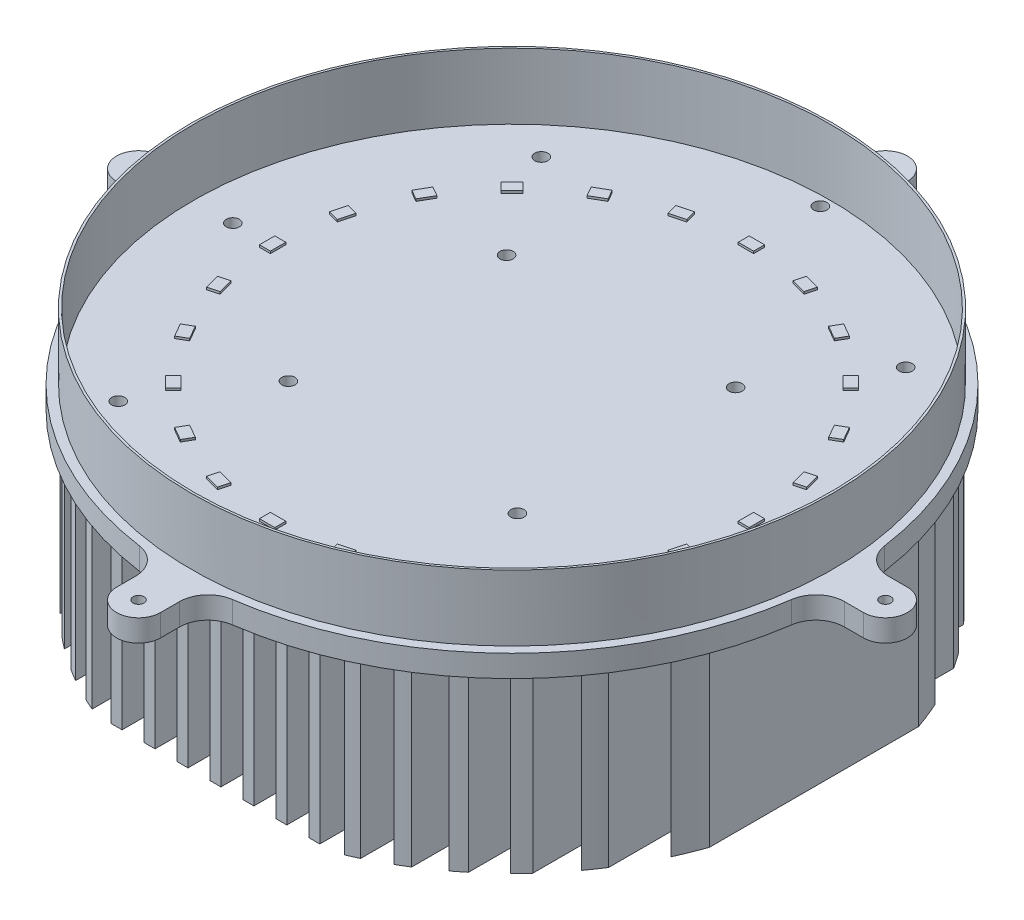
from build123d import *

# Parameters (mm, degrees)
SKETCH2_R           = 146
SKETCH2_R_2         = 145
BOSS_EXTRUDE2_DEPTH = 30
SKETCH3_R           = 2.5
BOSS_EXTRUDE4_DEPTH = 10
SKETCH4_W           = 5
SKETCH4_H           = 270
BOSS_EXTRUDE5_DEPTH = 80
BOSS_EXTRUDE6_DEPTH = 1
SKETCH7_R           = 3
CUT_EXTRUDE1_DEPTH  = 10


with BuildPart() as part:
    # Sketch2 → Boss-Extrude2 (new body)
    with BuildSketch(Plane(origin=(0, 0, 0), x_dir=(1, 0, 0), z_dir=(0, 1, 0))):
        Circle(SKETCH2_R)
        Circle(SKETCH2_R_2, mode=Mode.SUBTRACT)
    extrude(amount=BOSS_EXTRUDE2_DEPTH)

    # Sketch3 → Boss-Extrude4 (add)
    with BuildSketch(Plane(origin=(0, 0, 0), x_dir=(1, 0, 0), z_dir=(0, 1, 0))):
        with BuildLine():
            Line((161.369142032, 10), (170, 10))
            ThreePointArc((170, 10), (180, 0), (170, -10))
            Line((170, -10), (161.369142032, -10))
            ThreePointArc((161.369142032, -10), (152.849946816, -13.180462695), (148.499210458, -21.165644172))
            ThreePointArc((148.499210458, -21.165644172), (106.066017178, -106.066017178), (21.165644172, -148.499210458))
            ThreePointArc((21.165644172, -148.499210458), (13.180462695, -152.849946816), (10, -161.369142032))
            Line((10, -161.369142032), (10, -170))
            ThreePointArc((10, -170), (0, -180), (-10, -170))
            Line((-10, -170), (-10, -161.369142032))
            ThreePointArc((-10, -161.369142032), (-13.180462695, -152.849946816), (-21.165644172, -148.499210458))
            ThreePointArc((-21.165644172, -148.499210458), (-106.066017178, -106.066017178), (-148.499210458, -21.165644172))
            ThreePointArc((-148.499210458, -21.165644172), (-152.849946816, -13.180462695), (-161.369142032, -10))
            Line((-161.369142032, -10), (-170, -10))
            ThreePointArc((-170, -10), (-180, 0), (-170, 10))
            Line((-170, 10), (-161.369142032, 10))
            ThreePointArc((-161.369142032, 10), (-152.849946816, 13.180462695), (-148.499210458, 21.165644172))
            ThreePointArc((-148.499210458, 21.165644172), (-106.066017178, 106.066017178), (-21.165644172, 148.499210458))
            ThreePointArc((-21.165644172, 148.499210458), (-13.180462695, 152.849946816), (-10, 161.369142032))
            Line((-10, 161.369142032), (-10, 170))
            ThreePointArc((-10, 170), (0, 180), (10, 170))
            Line((10, 170), (10, 161.369142032))
            ThreePointArc((10, 161.369142032), (13.180462695, 152.849946816), (21.165644172, 148.499210458))
            ThreePointArc((21.165644172, 148.499210458), (106.066017178, 106.066017178), (148.499210458, 21.165644172))
            ThreePointArc((148.499210458, 21.165644172), (152.849946816, 13.180462695), (161.369142032, 10))
        make_face()
        with Locations((0, 170)):
            Circle(SKETCH3_R, mode=Mode.SUBTRACT)
        with Locations((170, 0)):
            Circle(SKETCH3_R, mode=Mode.SUBTRACT)
        with Locations((0, -170)):
            Circle(SKETCH3_R, mode=Mode.SUBTRACT)
        with Locations((-170, 0)):
            Circle(SKETCH3_R, mode=Mode.SUBTRACT)
    extrude(amount=-BOSS_EXTRUDE4_DEPTH)

    # Sketch4 → Boss-Extrude5 (add)
    with BuildSketch(Plane.XZ.offset(10)):
        Rectangle(SKETCH4_W, SKETCH4_H)
        with Locations((15, 0)):
            Rectangle(SKETCH4_W, SKETCH4_H)
        with Locations((30, 0)):
            Rectangle(SKETCH4_W, SKETCH4_H)
        with Locations((45, 0)):
            Rectangle(SKETCH4_W, SKETCH4_H)
        with BuildLine():
            Line((57.5, -133.656275573), (57.5, 133.656275573))
            ThreePointArc((57.5, 133.656275573), (60.010675074, 132.547987073), (62.5, 131.392541645))
            Line((62.5, 131.392541645), (62.5, -131.392541645))
            ThreePointArc((62.5, -131.392541645), (60.010675074, -132.547987073), (57.5, -133.656275573))
        make_face()
        with BuildLine():
            Line((72.5, -126.150703526), (72.5, 126.150703526))
            ThreePointArc((72.5, 126.150703526), (75.015083697, 124.671517268), (77.5, 123.142194231))
            Line((77.5, 123.142194231), (77.5, -123.142194231))
            ThreePointArc((77.5, -123.142194231), (75.015083697, -124.671517268), (72.5, -126.150703526))
        make_face()
        with BuildLine():
            Line((87.5, -116.249731182), (87.5, 116.249731182))
            ThreePointArc((87.5, 116.249731182), (90.021532442, 114.308239846), (92.5, 112.312065247))
            Line((92.5, 112.312065247), (92.5, -112.312065247))
            ThreePointArc((92.5, -112.312065247), (90.021532442, -114.308239846), (87.5, -116.249731182))
        make_face()
        with BuildLine():
            Line((102.5, -103.266645147), (102.5, 103.266645147))
            ThreePointArc((102.5, 103.266645147), (105.032379388, 100.689866819), (107.5, 98.051007134))
            Line((107.5, 98.051007134), (107.5, -98.051007134))
            ThreePointArc((107.5, -98.051007134), (105.032379388, -100.689866819), (102.5, -103.266645147))
        make_face()
        with BuildLine():
            Line((117.5, -85.813751812), (117.5, 85.813751812))
            ThreePointArc((117.5, 85.813751812), (120.055537207, 82.200474366), (122.5, 78.511145706))
            Line((122.5, 78.511145706), (122.5, -78.511145706))
            ThreePointArc((122.5, -78.511145706), (120.055537207, -82.200474366), (117.5, -85.813751812))
        make_face()
        with BuildLine():
            Line((132.5, -60.116553461), (132.5, 60.116553461))
            ThreePointArc((132.5, 60.116553461), (135.145409966, 53.907032613), (137.5, 47.581509013))
            Line((137.5, 47.581509013), (137.5, -47.581509013))
            ThreePointArc((137.5, -47.581509013), (135.145409966, -53.907032613), (132.5, -60.116553461))
        make_face()
        with Locations((-15, 0)):
            Rectangle(SKETCH4_W, SKETCH4_H)
        with Locations((-30, 0)):
            Rectangle(SKETCH4_W, SKETCH4_H)
        with Locations((-45, 0)):
            Rectangle(SKETCH4_W, SKETCH4_H)
        with BuildLine():
            Line((-57.5, -133.656275573), (-57.5, 133.656275573))
            ThreePointArc((-57.5, 133.656275573), (-60.010675074, 132.547987073), (-62.5, 131.392541645))
            Line((-62.5, 131.392541645), (-62.5, -131.392541645))
            ThreePointArc((-62.5, -131.392541645), (-60.010675074, -132.547987073), (-57.5, -133.656275573))
        make_face()
        with BuildLine():
            Line((-72.5, -126.150703526), (-72.5, 126.150703526))
            ThreePointArc((-72.5, 126.150703526), (-75.015083697, 124.671517268), (-77.5, 123.142194231))
            Line((-77.5, 123.142194231), (-77.5, -123.142194231))
            ThreePointArc((-77.5, -123.142194231), (-75.015083697, -124.671517268), (-72.5, -126.150703526))
        make_face()
        with BuildLine():
            Line((-87.5, -116.249731182), (-87.5, 116.249731182))
            ThreePointArc((-87.5, 116.249731182), (-90.021532442, 114.308239846), (-92.5, 112.312065247))
            Line((-92.5, 112.312065247), (-92.5, -112.312065247))
            ThreePointArc((-92.5, -112.312065247), (-90.021532442, -114.308239846), (-87.5, -116.249731182))
        make_face()
        with BuildLine():
            Line((-102.5, -103.266645147), (-102.5, 103.266645147))
            ThreePointArc((-102.5, 103.266645147), (-105.032379388, 100.689866819), (-107.5, 98.051007134))
            Line((-107.5, 98.051007134), (-107.5, -98.051007134))
            ThreePointArc((-107.5, -98.051007134), (-105.032379388, -100.689866819), (-102.5, -103.266645147))
        make_face()
        with BuildLine():
            Line((-117.5, -85.813751812), (-117.5, 85.813751812))
            ThreePointArc((-117.5, 85.813751812), (-120.055537207, 82.200474366), (-122.5, 78.511145706))
            Line((-122.5, 78.511145706), (-122.5, -78.511145706))
            ThreePointArc((-122.5, -78.511145706), (-120.055537207, -82.200474366), (-117.5, -85.813751812))
        make_face()
        with BuildLine():
            Line((-132.5, -60.116553461), (-132.5, 60.116553461))
            ThreePointArc((-132.5, 60.116553461), (-135.145409966, 53.907032613), (-137.5, 47.581509013))
            Line((-137.5, 47.581509013), (-137.5, -47.581509013))
            ThreePointArc((-137.5, -47.581509013), (-135.145409966, -53.907032613), (-132.5, -60.116553461))
        make_face()
    extrude(amount=BOSS_EXTRUDE5_DEPTH)

    # Sketch5 → Boss-Extrude6 (add)
    with BuildSketch(Plane(origin=(0, 0, 0), x_dir=(1, 0, 0), z_dir=(0, 1, 0))):
        Polygon((0, 111.478572259), (3.5, 111.478572259), (3.5, 106.478572259), (0, 106.478572259), (-3.5, 106.478572259), (-3.5, 111.478572259), align=None)
        Polygon((24.177942004, 103.756269549), (25.472037229, 108.585898681), (28.852777621, 107.680032023), (32.233518013, 106.774165365), (30.939422788, 101.944536234), (27.558682396, 102.850402891), align=None)
        Polygon((50.208197216, 93.963148535), (52.708197216, 98.293275554), (55.73928613, 96.543275554), (58.770375043, 94.793275554), (56.270375043, 90.463148535), (53.23928613, 92.213148535), align=None)
        Polygon((72.816846761, 77.76659423), (76.352380667, 81.302128135), (78.827254401, 78.827254401), (81.302128135, 76.352380667), (77.76659423, 72.816846761), (75.291720495, 75.291720495), align=None)
        Polygon((90.463148535, 56.270375043), (94.793275554, 58.770375043), (96.543275554, 55.73928613), (98.293275554, 52.708197216), (93.963148535, 50.208197216), (92.213148535, 53.23928613), align=None)
        Polygon((101.944536234, 30.939422788), (106.774165365, 32.233518013), (107.680032023, 28.852777621), (108.585898681, 25.472037229), (103.756269549, 24.177942004), (102.850402891, 27.558682396), align=None)
        Polygon((106.478572259, 3.5), (111.478572259, 3.5), (111.478572259, 0), (111.478572259, -3.5), (106.478572259, -3.5), (106.478572259, 0), align=None)
        Polygon((103.756269549, -24.177942004), (108.585898681, -25.472037229), (107.680032023, -28.852777621), (106.774165365, -32.233518013), (101.944536234, -30.939422788), (102.850402891, -27.558682396), align=None)
        Polygon((93.963148535, -50.208197216), (98.293275554, -52.708197216), (96.543275554, -55.73928613), (94.793275554, -58.770375043), (90.463148535, -56.270375043), (92.213148535, -53.23928613), align=None)
        Polygon((77.76659423, -72.816846761), (81.302128135, -76.352380667), (78.827254401, -78.827254401), (76.352380667, -81.302128135), (72.816846761, -77.76659423), (75.291720495, -75.291720495), align=None)
        Polygon((56.270375043, -90.463148535), (58.770375043, -94.793275554), (55.73928613, -96.543275554), (52.708197216, -98.293275554), (50.208197216, -93.963148535), (53.23928613, -92.213148535), align=None)
        Polygon((30.939422788, -101.944536234), (32.233518013, -106.774165365), (28.852777621, -107.680032023), (25.472037229, -108.585898681), (24.177942004, -103.756269549), (27.558682396, -102.850402891), align=None)
        Polygon((3.5, -106.478572259), (3.5, -111.478572259), (0, -111.478572259), (-3.5, -111.478572259), (-3.5, -106.478572259), (0, -106.478572259), align=None)
        Polygon((-24.177942004, -103.756269549), (-25.472037229, -108.585898681), (-28.852777621, -107.680032023), (-32.233518013, -106.774165365), (-30.939422788, -101.944536234), (-27.558682396, -102.850402891), align=None)
        Polygon((-50.208197216, -93.963148535), (-52.708197216, -98.293275554), (-55.73928613, -96.543275554), (-58.770375043, -94.793275554), (-56.270375043, -90.463148535), (-53.23928613, -92.213148535), align=None)
        Polygon((-72.816846761, -77.76659423), (-76.352380667, -81.302128135), (-78.827254401, -78.827254401), (-81.302128135, -76.352380667), (-77.76659423, -72.816846761), (-75.291720495, -75.291720495), align=None)
        Polygon((-90.463148535, -56.270375043), (-94.793275554, -58.770375043), (-96.543275554, -55.73928613), (-98.293275554, -52.708197216), (-93.963148535, -50.208197216), (-92.213148535, -53.23928613), align=None)
        Polygon((-101.944536234, -30.939422788), (-106.774165365, -32.233518013), (-107.680032023, -28.852777621), (-108.585898681, -25.472037229), (-103.756269549, -24.177942004), (-102.850402891, -27.558682396), align=None)
        Polygon((-106.478572259, -3.5), (-111.478572259, -3.5), (-111.478572259, 0), (-111.478572259, 3.5), (-106.478572259, 3.5), (-106.478572259, 0), align=None)
        Polygon((-103.756269549, 24.177942004), (-108.585898681, 25.472037229), (-107.680032023, 28.852777621), (-106.774165365, 32.233518013), (-101.944536234, 30.939422788), (-102.850402891, 27.558682396), align=None)
        Polygon((-93.963148535, 50.208197216), (-98.293275554, 52.708197216), (-96.543275554, 55.73928613), (-94.793275554, 58.770375043), (-90.463148535, 56.270375043), (-92.213148535, 53.23928613), align=None)
        Polygon((-77.76659423, 72.816846761), (-81.302128135, 76.352380667), (-78.827254401, 78.827254401), (-76.352380667, 81.302128135), (-72.816846761, 77.76659423), (-75.291720495, 75.291720495), align=None)
        Polygon((-56.270375043, 90.463148535), (-58.770375043, 94.793275554), (-55.73928613, 96.543275554), (-52.708197216, 98.293275554), (-50.208197216, 93.963148535), (-53.23928613, 92.213148535), align=None)
        Polygon((-30.939422788, 101.944536234), (-32.233518013, 106.774165365), (-28.852777621, 107.680032023), (-25.472037229, 108.585898681), (-24.177942004, 103.756269549), (-27.558682396, 102.850402891), align=None)
    extrude(amount=BOSS_EXTRUDE6_DEPTH)

    # Sketch7 → Cut-Extrude1 (cut)
    with BuildSketch(Plane(origin=(0, 0, 0), x_dir=(1, 0, 0), z_dir=(0, 1, 0))):
        with Locations((-127.088241501, 0)):
            Circle(SKETCH7_R)
        with Locations((0, 140.377871213)):
            Circle(SKETCH7_R)
        with Locations((0, -140.377871213)):
            Circle(SKETCH7_R)
        with Locations((127.088241501, 0)):
            Circle(SKETCH7_R)
        with Locations((-52.130916661, 49.662536464)):
            Circle(SKETCH7_R)
        with Locations((52.130916661, 49.662536464)):
            Circle(SKETCH7_R)
        with Locations((52.130916661, -49.662536464)):
            Circle(SKETCH7_R)
        with Locations((-52.130916661, -49.662536464)):
            Circle(SKETCH7_R)
        with Locations((-82.954299453, 96.280866896)):
            Circle(SKETCH7_R)
        with Locations((82.954299453, 96.280866896)):
            Circle(SKETCH7_R)
        with Locations((82.954299453, -96.280866896)):
            Circle(SKETCH7_R)
        with Locations((-82.954299453, -96.280866896)):
            Circle(SKETCH7_R)
    extrude(amount=-CUT_EXTRUDE1_DEPTH, mode=Mode.SUBTRACT)


solid = part.part
